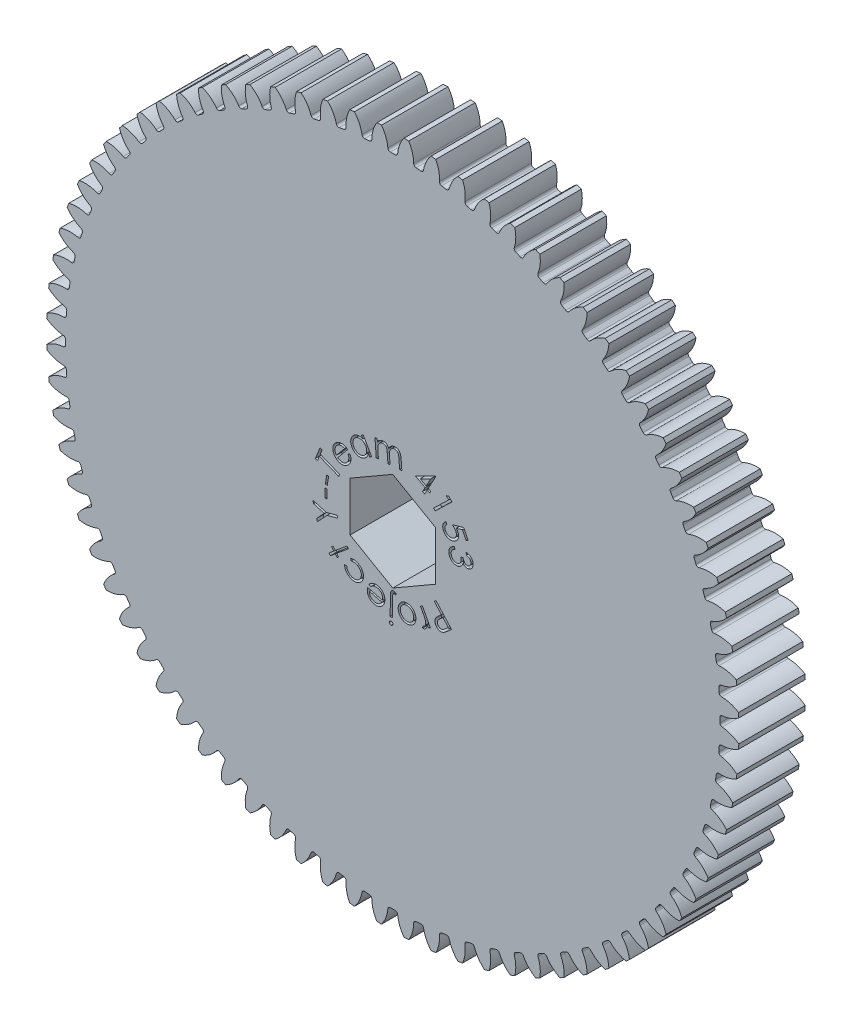
from build123d import *

# Parameters (mm, degrees)
SKETCH1_R                = 52.07
SKETCH1_R_2              = 5
BOSS_EXTRUDE1_DEPTH      = 5
CUT_EXTRUDE1_DEPTH       = 74.807654075
FILLET1_R                = 0.381
CIRPATTERN1_COUNT        = 80
FILLET1_OF_CIRPATTERN1_R = 0.381
CUT_EXTRUDE3_DEPTH       = 75.275471216
CUT_EXTRUDE3_DEPTH_BACK  = 75.275471216
CUT_EXTRUDE4_DEPTH       = 1


with BuildPart() as part:
    # Sketch1 → Boss-Extrude1 (new, symmetric)
    with BuildSketch(Plane.XY):
        Circle(SKETCH1_R)
        Circle(SKETCH1_R_2, mode=Mode.SUBTRACT)
    extrude(amount=BOSS_EXTRUDE1_DEPTH, both=True)

    # Sketch2 → Cut-Extrude1 (cut, symmetric)
    with BuildSketch(Plane.XY):
        with BuildLine():
            ThreePointArc((0.721340206, 49.207213135), (0, 49.2125), (-0.721340206, 49.207213135))
            ThreePointArc((-0.721340206, 49.207213135), (-0.981330856, 50.701949285), (-1.691773999, 52.042509555))
            ThreePointArc((-1.691773999, 52.042509555), (0, 52.07), (1.691773999, 52.042509555))
            ThreePointArc((1.691773999, 52.042509555), (0.981330856, 50.701949285), (0.721340206, 49.207213135))
        make_face()
    cut_extrude1 = extrude(amount=CUT_EXTRUDE1_DEPTH, both=True, mode=Mode.SUBTRACT)

    # Fillet1
    fillet1_edges = [part.edges().sort_by_distance(p)[0] for p in [
        (0.721340206, 49.207213135, 0),
        (-0.721340206, 49.207213135, 0),
    ]]
    fillet(fillet1_edges, radius=FILLET1_R)

    # CirPattern1: Cut-Extrude1 ×80 about axis
    cirpattern1_axis = Axis((0, 0, 5), (0, 0, 1))
    for i in range(1, CIRPATTERN1_COUNT):
        add(cut_extrude1.rotate(cirpattern1_axis, i * 360 / CIRPATTERN1_COUNT), mode=Mode.SUBTRACT)

    # Fillet1 of CirPattern1
    fillet1_of_cirpattern1_edges = [part.edges().sort_by_distance(p)[0] for p in [
        (-3.141636891, 49.11211942, 0),
        (-4.579870001, 48.998928019, 0),
        (-6.985244752, 48.714233156, 0),
        (-8.410163374, 48.488548218, 0),
        (-10.785786256, 48.016007446, 0),
        (-12.188605294, 47.679220393, 0),
        (-14.519829801, 47.021747084, 0),
        (-15.891900408, 46.575934319, 0),
        (-18.164353767, 45.737582014, 0),
        (-19.497216672, 45.185492122, 0),
        (-21.696888452, 44.171429542, 0),
        (-22.982326112, 43.51646634, 0),
        (-25.095654605, 42.332945518, 0),
        (-26.325741869, 41.579147073, 0),
        (-28.339697702, 40.233464807, 0),
        (-29.506850673, 39.385478537, 0),
        (-31.409017139, 37.885931408, 0),
        (-32.506039931, 36.94898543, 0),
        (-34.28468954, 35.304818643, 0),
        (-35.304818643, 34.28468954, 0),
        (-36.94898543, 32.506039931, 0),
        (-37.885931408, 31.409017139, 0),
        (-39.385478537, 29.506850673, 0),
        (-40.233464807, 28.339697702, 0),
        (-41.579147073, 26.325741869, 0),
        (-42.332945518, 25.095654605, 0),
        (-43.51646634, 22.982326112, 0),
        (-44.171429542, 21.696888452, 0),
        (-45.185492122, 19.497216672, 0),
        (-45.737582014, 18.164353767, 0),
        (-46.575934319, 15.891900408, 0),
        (-47.021747084, 14.519829801, 0),
        (-47.679220393, 12.188605294, 0),
        (-48.016007446, 10.785786256, 0),
        (-48.488548218, 8.410163374, 0),
        (-48.714233156, 6.985244752, 0),
        (-48.998928019, 4.579870001, 0),
        (-49.11211942, 3.141636891, 0),
        (-49.207213135, 0.721340206, 0),
        (-49.207213135, -0.721340206, 0),
        (-49.11211942, -3.141636891, 0),
        (-48.998928019, -4.579870001, 0),
        (-48.714233156, -6.985244752, 0),
        (-48.488548218, -8.410163374, 0),
        (-48.016007446, -10.785786256, 0),
        (-47.679220393, -12.188605294, 0),
        (-47.021747084, -14.519829801, 0),
        (-46.575934319, -15.891900408, 0),
        (-45.737582014, -18.164353767, 0),
        (-45.185492122, -19.497216672, 0),
        (-44.171429542, -21.696888452, 0),
        (-43.51646634, -22.982326112, 0),
        (-42.332945518, -25.095654605, 0),
        (-41.579147073, -26.325741869, 0),
        (-40.233464807, -28.339697702, 0),
        (-39.385478537, -29.506850673, 0),
        (-37.885931408, -31.409017139, 0),
        (-36.94898543, -32.506039931, 0),
        (-35.304818643, -34.28468954, 0),
        (-34.28468954, -35.304818643, 0),
        (-32.506039931, -36.94898543, 0),
        (-31.409017139, -37.885931408, 0),
        (-29.506850673, -39.385478537, 0),
        (-28.339697702, -40.233464807, 0),
        (-26.325741869, -41.579147073, 0),
        (-25.095654605, -42.332945518, 0),
        (-22.982326112, -43.51646634, 0),
        (-21.696888452, -44.171429542, 0),
        (-19.497216672, -45.185492122, 0),
        (-18.164353767, -45.737582014, 0),
        (-15.891900408, -46.575934319, 0),
        (-14.519829801, -47.021747084, 0),
        (-12.188605294, -47.679220393, 0),
        (-10.785786256, -48.016007446, 0),
        (-8.410163374, -48.488548218, 0),
        (-6.985244752, -48.714233156, 0),
        (-4.579870001, -48.998928019, 0),
        (-3.141636891, -49.11211942, 0),
        (-0.721340206, -49.207213135, 0),
        (0.721340206, -49.207213135, 0),
        (3.141636891, -49.11211942, 0),
        (4.579870001, -48.998928019, 0),
        (6.985244752, -48.714233156, 0),
        (8.410163374, -48.488548218, 0),
        (10.785786256, -48.016007446, 0),
        (12.188605294, -47.679220393, 0),
        (14.519829801, -47.021747084, 0),
        (15.891900408, -46.575934319, 0),
        (18.164353767, -45.737582014, 0),
        (19.497216672, -45.185492122, 0),
        (21.696888452, -44.171429542, 0),
        (22.982326112, -43.51646634, 0),
        (25.095654605, -42.332945518, 0),
        (26.325741869, -41.579147073, 0),
        (28.339697702, -40.233464807, 0),
        (29.506850673, -39.385478537, 0),
        (31.409017139, -37.885931408, 0),
        (32.506039931, -36.94898543, 0),
        (34.28468954, -35.304818643, 0),
        (35.304818643, -34.28468954, 0),
        (36.94898543, -32.506039931, 0),
        (37.885931408, -31.409017139, 0),
        (39.385478537, -29.506850673, 0),
        (40.233464807, -28.339697702, 0),
        (41.579147073, -26.325741869, 0),
        (42.332945518, -25.095654605, 0),
        (43.51646634, -22.982326112, 0),
        (44.171429542, -21.696888452, 0),
        (45.185492122, -19.497216672, 0),
        (45.737582014, -18.164353767, 0),
        (46.575934319, -15.891900408, 0),
        (47.021747084, -14.519829801, 0),
        (47.679220393, -12.188605294, 0),
        (48.016007446, -10.785786256, 0),
        (48.488548218, -8.410163374, 0),
        (48.714233156, -6.985244752, 0),
        (48.998928019, -4.579870001, 0),
        (49.11211942, -3.141636891, 0),
        (49.207213135, -0.721340206, 0),
        (49.207213135, 0.721340206, 0),
        (49.11211942, 3.141636891, 0),
        (48.998928019, 4.579870001, 0),
        (48.714233156, 6.985244752, 0),
        (48.488548218, 8.410163374, 0),
        (48.016007446, 10.785786256, 0),
        (47.679220393, 12.188605294, 0),
        (47.021747084, 14.519829801, 0),
        (46.575934319, 15.891900408, 0),
        (45.737582014, 18.164353767, 0),
        (45.185492122, 19.497216672, 0),
        (44.171429542, 21.696888452, 0),
        (43.51646634, 22.982326112, 0),
        (42.332945518, 25.095654605, 0),
        (41.579147073, 26.325741869, 0),
        (40.233464807, 28.339697702, 0),
        (39.385478537, 29.506850673, 0),
        (37.885931408, 31.409017139, 0),
        (36.94898543, 32.506039931, 0),
        (35.304818643, 34.28468954, 0),
        (34.28468954, 35.304818643, 0),
        (32.506039931, 36.94898543, 0),
        (31.409017139, 37.885931408, 0),
        (29.506850673, 39.385478537, 0),
        (28.339697702, 40.233464807, 0),
        (26.325741869, 41.579147073, 0),
        (25.095654605, 42.332945518, 0),
        (22.982326112, 43.51646634, 0),
        (21.696888452, 44.171429542, 0),
        (19.497216672, 45.185492122, 0),
        (18.164353767, 45.737582014, 0),
        (15.891900408, 46.575934319, 0),
        (14.519829801, 47.021747084, 0),
        (12.188605294, 47.679220393, 0),
        (10.785786256, 48.016007446, 0),
        (8.410163374, 48.488548218, 0),
        (6.985244752, 48.714233156, 0),
        (4.579870001, 48.998928019, 0),
        (3.141636891, 49.11211942, 0),
    ]]
    fillet(fillet1_of_cirpattern1_edges, radius=FILLET1_OF_CIRPATTERN1_R)

    # Sketch4 → Cut-Extrude3 (cut, two sides: drawn at the far end of the back side and taken through both)
    with BuildSketch(Plane.XY.offset(5).offset(-CUT_EXTRUDE3_DEPTH_BACK)):
        Polygon((6.4135, -3.702835951), (6.4135, 3.702835951), (0, 7.405671903), (-6.4135, 3.702835951), (-6.4135, -3.702835951), (0, -7.405671903), align=None)
    extrude(amount=CUT_EXTRUDE3_DEPTH + CUT_EXTRUDE3_DEPTH_BACK, mode=Mode.SUBTRACT)

    # Sketch5 → Cut-Extrude4 (cut)
    # profile 1 of 19: a face of its own
    with BuildSketch(Plane.XY.offset(5)):
        with BuildLine():
            Line((11.086994033, 2.421998523), (11.033007655, 2.773260543))
            add(Edge.make_bspline(
                [(11.033007655, 2.773260543), (11.069051737, 2.770234986), (11.139562984, 2.76431624), (11.242285705, 2.74751915), (11.339480745, 2.723520747), (11.431617048, 2.693363378), (11.51861601, 2.657245184), (11.599848498, 2.613955679), (11.67613507, 2.564830377), (11.746515926, 2.508847553), (11.811038097, 2.447674595), (11.869880946, 2.382492868), (11.920618982, 2.311928181), (11.966325535, 2.238421527), (12.003026715, 2.15962258), (12.035130397, 2.077455062), (12.0596839, 1.990542833), (12.070243914, 1.930619673), (12.075575764, 1.900363908)],
                knots=[0, 0, 0, 0, 1.172447719, 2.293601181, 3.370557348, 4.415309804, 5.434186328, 6.42059287, 7.395818156, 8.372132045, 9.331598375, 10.276137389, 11.21430245, 12.146080765, 13.078136337, 14.028009717, 15.004323606, 16, 16, 16, 16], degree=3))
            add(Edge.make_bspline(
                [(12.075575764, 1.900363908), (12.080940789, 1.856025554), (12.09159257, 1.767995681), (12.087052041, 1.635597236), (12.068564196, 1.50502285), (12.032476351, 1.378593452), (11.983567917, 1.25842715), (11.920513738, 1.14862502), (11.845189409, 1.049874318), (11.756591557, 0.965087276), (11.660343649, 0.89283282), (11.558140269, 0.835506587), (11.450705304, 0.793526765), (11.376147053, 0.778436482), (11.338696757, 0.770856697)],
                knots=[0, 0, 0, 0, 1.073801399, 2.131937515, 3.178280427, 4.241728444, 5.288676267, 6.29430666, 7.281253805, 8.268040562, 9.236908235, 10.171397922, 11.081500861, 12, 12, 12, 12], degree=3))
            add(Edge.make_bspline(
                [(11.338696757, 0.770856697), (11.302293122, 0.766538455), (11.230523816, 0.758025097), (11.123257559, 0.763487527), (11.019772731, 0.782970421), (10.920285801, 0.81818088), (10.824382625, 0.867508532), (10.732721136, 0.932464967), (10.644326873, 1.011396754), (10.591322372, 1.072858936), (10.563957174, 1.104590671)],
                knots=[0, 0, 0, 0, 0.991004746, 1.953753338, 2.894354245, 3.832846011, 4.800633632, 5.804661443, 6.866589197, 8, 8, 8, 8], degree=3))
            add(Edge.make_bspline(
                [(10.563957174, 1.104590671), (10.552440835, 1.06167913), (10.529812612, 0.977363103), (10.477287039, 0.858777728), (10.413268025, 0.748296138), (10.359043605, 0.683444932), (10.33188586, 0.65096487)],
                knots=[0, 0, 0, 0, 1.034396071, 2.032464112, 3.014579789, 4, 4, 4, 4], degree=3))
            add(Edge.make_bspline(
                [(10.33188586, 0.65096487), (10.311903857, 0.629576692), (10.272354791, 0.587244478), (10.207393962, 0.530469411), (10.139527603, 0.479862312), (10.068454569, 0.436150559), (9.99421259, 0.39951687), (9.916913473, 0.369156867), (9.836085965, 0.345952065), (9.780669317, 0.33571035), (9.752759257, 0.330552209)],
                knots=[0, 0, 0, 0, 1.039473192, 2.057360955, 3.060508799, 4.044641187, 5.017639541, 5.998402805, 6.991914902, 8, 8, 8, 8], degree=3))
            add(Edge.make_bspline(
                [(9.752759257, 0.330552209), (9.70398357, 0.324970448), (9.606788746, 0.313847729), (9.45914741, 0.321766521), (9.312527827, 0.349639055), (9.192343374, 0.388136942), (9.098441109, 0.427513546), (9.031239966, 0.463151715), (8.96643803, 0.501350911), (8.90523274, 0.544509972), (8.847188337, 0.591387971), (8.791884799, 0.64220203), (8.740398164, 0.697524206), (8.675463656, 0.776231791), (8.605035807, 0.883647155), (8.536385479, 1.0231809), (8.484186048, 1.173396202), (8.464827586, 1.278834483), (8.454982815, 1.332455254)],
                knots=[0, 0, 0, 0, 1.288308155, 2.567198802, 3.866874602, 5.201203046, 5.875361937, 6.540112058, 7.198390841, 7.850943727, 8.50603484, 9.157951624, 9.822730113, 10.490339387, 11.837677745, 13.186247264, 14.569062503, 16, 16, 16, 16], degree=3))
            add(Edge.make_bspline(
                [(8.454982815, 1.332455254), (8.449918343, 1.369084603), (8.44001441, 1.440715871), (8.435963868, 1.547495088), (8.440846195, 1.650683619), (8.454123792, 1.750633029), (8.475817872, 1.847429257), (8.506714884, 1.940604881), (8.546354737, 2.030542118), (8.594613985, 2.116533923), (8.651613247, 2.198523029), (8.718032393, 2.274688532), (8.791764857, 2.346974146), (8.874918698, 2.41251299), (8.966093119, 2.473288031), (9.065787802, 2.528490336), (9.17414349, 2.578446946), (9.250317562, 2.606668185), (9.289317751, 2.621117113)],
                knots=[0, 0, 0, 0, 1.050901157, 2.055111177, 3.033055656, 3.98507683, 4.918478486, 5.849393119, 6.771729907, 7.708908621, 8.649074573, 9.605538197, 10.578298808, 11.58081444, 12.611070449, 13.690882352, 14.817760126, 16, 16, 16, 16], degree=3))
            Line((9.289317751, 2.621117113), (9.341901886, 2.28387753))
            add(Edge.make_bspline(
                [(9.341901886, 2.28387753), (9.316039577, 2.272278053), (9.265747962, 2.249721815), (9.19486046, 2.211485131), (9.129878959, 2.172335145), (9.070069858, 2.132667503), (9.017881996, 2.089726286), (8.97120874, 2.046014468), (8.929745511, 2.001394888), (8.907090748, 1.968881662), (8.895988424, 1.952948043)],
                knots=[0, 0, 0, 0, 1.208766921, 2.35055732, 3.432823086, 4.444852479, 5.408641591, 6.311409378, 7.172479543, 8, 8, 8, 8], degree=3))
            add(Edge.make_bspline(
                [(8.895988424, 1.952948043), (8.883613773, 1.932626979), (8.858823868, 1.891918172), (8.82990084, 1.82650525), (8.806462243, 1.758774572), (8.78944712, 1.688377598), (8.779873542, 1.615050019), (8.7765282, 1.539081506), (8.778964233, 1.46021418), (8.786349466, 1.40719405), (8.790119033, 1.380131536)],
                knots=[0, 0, 0, 0, 0.957190044, 1.917520847, 2.872858562, 3.840676453, 4.828242219, 5.845712199, 6.900409282, 8, 8, 8, 8], degree=3))
            add(Edge.make_bspline(
                [(8.790119033, 1.380131536), (8.79533379, 1.349606918), (8.805510342, 1.290038398), (8.831043817, 1.20477483), (8.860490975, 1.124628109), (8.897371429, 1.050504972), (8.940138987, 0.981796989), (8.990320533, 0.919503395), (9.045946398, 0.862161543), (9.107375466, 0.811249751), (9.173106551, 0.767601724), (9.240268299, 0.730237441), (9.308934681, 0.700171264), (9.37915571, 0.678799073), (9.450660919, 0.663530184), (9.523560511, 0.65674123), (9.597817683, 0.65730057), (9.647161374, 0.66333567), (9.672130251, 0.666389549)],
                knots=[0, 0, 0, 0, 1.172367416, 2.287864531, 3.366872934, 4.404530791, 5.419299552, 6.427555365, 7.429569015, 8.442132722, 9.444263769, 10.415393542, 11.351487895, 12.278658844, 13.19223836, 14.117504117, 15.047420117, 16, 16, 16, 16], degree=3))
            add(Edge.make_bspline(
                [(9.672130251, 0.666389549), (9.705135965, 0.672825982), (9.770748089, 0.685620979), (9.864099836, 0.723359684), (9.951941555, 0.773767415), (10.03358679, 0.836482027), (10.106201468, 0.910612858), (10.167962551, 0.993609824), (10.215669027, 1.08546438), (10.246172372, 1.167972876), (10.263392577, 1.239991342), (10.274077062, 1.300826516), (10.280778499, 1.367840466), (10.284033646, 1.441091184), (10.284612467, 1.520365888), (10.282630739, 1.605732809), (10.276713326, 1.697362281), (10.271032105, 1.760385643), (10.268083777, 1.793092273)],
                knots=[0, 0, 0, 0, 1.126395439, 2.23916374, 3.359892192, 4.517664301, 5.682402785, 6.83228393, 7.976049784, 9.144716571, 9.774390764, 10.459106666, 11.21614727, 12.032803173, 12.919142219, 13.876326435, 14.897897457, 16, 16, 16, 16], degree=3))
            Line((10.268083777, 1.793092273), (10.584990828, 1.842170799))
            add(Edge.make_bspline(
                [(10.584990828, 1.842170799), (10.591968516, 1.803676293), (10.60565011, 1.728197682), (10.63840414, 1.619448695), (10.680146352, 1.517461119), (10.731790851, 1.424037849), (10.789999812, 1.341586819), (10.851697392, 1.2707362), (10.91807854, 1.214580246), (10.988220125, 1.172376839), (11.061134672, 1.144551814), (11.13493824, 1.127375321), (11.210269794, 1.120995239), (11.260203546, 1.126866885), (11.285411501, 1.129831056)],
                knots=[0, 0, 0, 0, 1.265675655, 2.481690249, 3.668955865, 4.827104902, 5.92915607, 6.931314669, 7.86031793, 8.732267783, 9.568255349, 10.375787383, 11.180052055, 12, 12, 12, 12], degree=3))
            add(Edge.make_bspline(
                [(11.285411501, 1.129831056), (11.303732776, 1.133172296), (11.340173373, 1.139817946), (11.392699552, 1.156713803), (11.442151902, 1.179432965), (11.488711461, 1.207179486), (11.533233131, 1.239121486), (11.57403121, 1.277839121), (11.61258916, 1.321003044), (11.647472334, 1.369611212), (11.678556537, 1.421355765), (11.705246386, 1.475740637), (11.724371097, 1.532976414), (11.739453561, 1.591969883), (11.748400096, 1.653283992), (11.75209909, 1.71664864), (11.748958368, 1.782093166), (11.74331428, 1.826077905), (11.740439546, 1.848480895)],
                knots=[0, 0, 0, 0, 0.943453473, 1.876507356, 2.788483302, 3.696834314, 4.621119835, 5.560098406, 6.542123571, 7.551781074, 8.588131372, 9.600358071, 10.61583897, 11.641773422, 12.684067383, 13.752107446, 14.85506841, 16, 16, 16, 16], degree=3))
            add(Edge.make_bspline(
                [(11.740439546, 1.848480895), (11.73339487, 1.884306294), (11.719682628, 1.954039319), (11.680348281, 2.052031004), (11.625461559, 2.139133786), (11.568461771, 2.203586625), (11.515076845, 2.249416467), (11.469436004, 2.281811504), (11.418031714, 2.310637258), (11.362259962, 2.338761051), (11.300661739, 2.362474199), (11.234320233, 2.385189589), (11.162785934, 2.405690823), (11.112773155, 2.416451781), (11.086994033, 2.421998523)],
                knots=[0, 0, 0, 0, 1.402466647, 2.729857699, 4.034642752, 5.34659565, 6.02245237, 6.738446215, 7.49570687, 8.287874755, 9.1394096, 10.032239796, 10.985716623, 12, 12, 12, 12], degree=3))
        make_face()
    # profile 2 of 19: a face of its own
    with BuildSketch(Plane.XY.offset(5)):
        with BuildLine():
            Line((11.33494142, 4.460609964), (11.037665779, 4.313374387))
            Line((11.037665779, 4.313374387), (10.485181805, 5.426755797))
            Line((10.485181805, 5.426755797), (9.555494305, 5.158226149))
            add(Edge.make_bspline(
                [(9.555494305, 5.158226149), (9.580870451, 5.129788662), (9.630219566, 5.074486138), (9.695721433, 4.989191169), (9.752364347, 4.905545826), (9.782671116, 4.848145999), (9.797381324, 4.820285444)],
                knots=[0, 0, 0, 0, 1.096731546, 2.132819274, 3.093713444, 4, 4, 4, 4], degree=3))
            add(Edge.make_bspline(
                [(9.797381324, 4.820285444), (9.814046514, 4.785077379), (9.846757445, 4.715969939), (9.881895544, 4.608446532), (9.908022674, 4.501893352), (9.920908215, 4.395085781), (9.924345558, 4.288896096), (9.914763484, 4.182892513), (9.894332005, 4.077178842), (9.862715281, 3.972808622), (9.821871957, 3.871280685), (9.770335091, 3.775534528), (9.709484001, 3.686013018), (9.640169192, 3.601981965), (9.5599767, 3.525469366), (9.471180953, 3.454620974), (9.373727017, 3.388526381), (9.302802887, 3.351890259), (9.266632126, 3.333206117)],
                knots=[0, 0, 0, 0, 1.055115737, 2.07101263, 3.060785946, 4.025123005, 4.982251176, 5.936270143, 6.904326313, 7.89663167, 8.888552574, 9.866594073, 10.838458406, 11.819307872, 12.814138826, 13.837360289, 14.897070359, 16, 16, 16, 16], degree=3))
            add(Edge.make_bspline(
                [(9.266632126, 3.333206117), (9.21525448, 3.309949999), (9.11396544, 3.264101461), (8.954575533, 3.21824709), (8.792848433, 3.194633539), (8.657162718, 3.191253348), (8.549825455, 3.199890627), (8.470998718, 3.210718879), (8.394632276, 3.228112665), (8.319823112, 3.248585668), (8.247811811, 3.275855803), (8.177251741, 3.306117363), (8.109774183, 3.343364429), (8.043889947, 3.384323982), (7.980962796, 3.430640721), (7.921207125, 3.481215778), (7.864738834, 3.536271778), (7.811624006, 3.596002326), (7.760847868, 3.660000433), (7.713372501, 3.728644364), (7.668923772, 3.801603146), (7.642747689, 3.852795421), (7.629512735, 3.878678874)],
                knots=[0, 0, 0, 0, 1.748019681, 3.446153187, 5.124778455, 6.807345338, 7.643732339, 8.464062161, 9.27332621, 10.07209539, 10.868128429, 11.66028845, 12.451917354, 13.256621032, 14.065852597, 14.873555991, 15.683696587, 16.510442191, 17.351811555, 18.216690737, 19.098336611, 20, 20, 20, 20], degree=3))
            add(Edge.make_bspline(
                [(7.629512735, 3.878678874), (7.614723022, 3.910236172), (7.58571654, 3.97212826), (7.551890874, 4.06762815), (7.527289091, 4.162896811), (7.511711078, 4.258163951), (7.505047303, 4.353269085), (7.509027035, 4.448100541), (7.520865489, 4.54293616), (7.541819925, 4.636815542), (7.57122841, 4.728540894), (7.608463642, 4.816593266), (7.653480809, 4.900025951), (7.705431094, 4.979171926), (7.765847736, 5.053107515), (7.833027634, 5.123346085), (7.908178192, 5.188795726), (7.962901088, 5.227622543), (7.990590459, 5.247268617)],
                knots=[0, 0, 0, 0, 1.075864627, 2.110051018, 3.123680859, 4.110960562, 5.087549161, 6.062642873, 7.037603, 8.035798582, 9.028761123, 10.008758047, 10.984038745, 11.952968548, 12.928062259, 13.928629814, 14.951902407, 16, 16, 16, 16], degree=3))
            Line((7.990590459, 5.247268617), (8.149745106, 4.926855957))
            add(Edge.make_bspline(
                [(8.149745106, 4.926855957), (8.124021725, 4.906127581), (8.074468299, 4.866196515), (8.010382449, 4.799564168), (7.956872291, 4.731639596), (7.915872997, 4.660280352), (7.884060999, 4.586308885), (7.863576093, 4.507771445), (7.850712985, 4.425090753), (7.84734562, 4.339001298), (7.853628578, 4.252004598), (7.869323443, 4.166524126), (7.89327199, 4.083095366), (7.917453184, 4.030556), (7.929592863, 4.004179675)],
                knots=[0, 0, 0, 0, 1.148081973, 2.211660849, 3.208426699, 4.148202182, 5.066207146, 6.000941125, 6.963265394, 7.972124082, 8.990923467, 9.990701451, 10.991272334, 12, 12, 12, 12], degree=3))
            add(Edge.make_bspline(
                [(7.929592863, 4.004179675), (7.942883215, 3.979342269), (7.969091773, 3.930362936), (8.016791698, 3.86258623), (8.069843821, 3.800780113), (8.12936278, 3.745521022), (8.194896795, 3.697148912), (8.266222375, 3.654693896), (8.343651259, 3.61915284), (8.425923042, 3.589722221), (8.511416347, 3.568334581), (8.597991185, 3.55458289), (8.684942149, 3.550605536), (8.771812923, 3.554748998), (8.859186097, 3.567564833), (8.946571725, 3.589266356), (9.034214251, 3.620468924), (9.091088948, 3.647064847), (9.12009767, 3.660629996)],
                knots=[0, 0, 0, 0, 0.978978879, 1.930545076, 2.875666987, 3.807412197, 4.748681455, 5.703574573, 6.689111553, 7.707194765, 8.738239498, 9.749877639, 10.75084679, 11.759934661, 12.770363861, 13.817179775, 14.886660859, 16, 16, 16, 16], degree=3))
            add(Edge.make_bspline(
                [(9.12009767, 3.660629996), (9.145607596, 3.673952453), (9.195781332, 3.700155486), (9.264803939, 3.746538062), (9.327418028, 3.796745277), (9.383245861, 3.85143288), (9.431279585, 3.911504681), (9.474366577, 3.974631391), (9.508259021, 4.043416739), (9.536589808, 4.115268923), (9.556672902, 4.19033385), (9.56956082, 4.266860351), (9.573724629, 4.344696595), (9.569434354, 4.423420733), (9.55664208, 4.503291361), (9.53506391, 4.584033378), (9.506742671, 4.666426191), (9.481463321, 4.720008586), (9.468555203, 4.747368778)],
                knots=[0, 0, 0, 0, 1.07408952, 2.112553545, 3.099415045, 4.068360443, 5.023887472, 5.967945677, 6.91643138, 7.880806255, 8.84837489, 9.812591774, 10.774079234, 11.752996888, 12.751674753, 13.78896446, 14.87100311, 16, 16, 16, 16], degree=3))
            add(Edge.make_bspline(
                [(9.468555203, 4.747368778), (9.456243298, 4.77068114), (9.43087704, 4.818711678), (9.385697462, 4.889348901), (9.33340323, 4.960948043), (9.274652509, 5.034129863), (9.207502002, 5.107208318), (9.134800299, 5.182771868), (9.053859366, 5.258039007), (8.99705727, 5.307939608), (8.967954241, 5.333506598)],
                knots=[0, 0, 0, 0, 0.81541681, 1.680005965, 2.591203579, 3.557863924, 4.581733205, 5.660676635, 6.801428136, 8, 8, 8, 8], degree=3))
            Line((8.967954241, 5.333506598), (10.663266741, 5.813775028))
            Line((10.663266741, 5.813775028), (11.33494142, 4.460609964))
        make_face()
    # profile 3 of 19: a face of its own
    with BuildSketch(Plane.XY.offset(5)):
        Polygon((8.425130471, 8.763383937), (8.903295535, 8.269794194), (6.389072779, 5.833395956), (6.147886881, 6.082995315), (8.416015887, 8.281012142), (8.033203387, 8.675743713), align=None)
    # profile 4 of 19: a face of its own
    with BuildSketch(Plane.XY.offset(5)):
        Polygon((6.424102862, 10.410243267), (6.486502701, 10.376589421), (5.338065201, 8.243075799), (5.708257509, 8.04395721), (5.549803984, 7.750187178), (5.179611676, 7.949305767), (4.796799176, 7.237667146), (4.490408951, 7.403131889), (4.873221451, 8.114770511), (3.409980266, 8.902130287), align=None)
        Polygon((5.031674977, 8.408540543), (5.718774336, 9.68458221), (4.130733471, 8.893015703), align=None, mode=Mode.SUBTRACT)
    # profile 5 of 19: a face of its own
    with BuildSketch(Plane.XY.offset(5)):
        with BuildLine():
            Line((-2.673284491, 10.873778749), (-2.34445837, 10.898318012))
            Line((-2.34445837, 10.898318012), (-2.311505645, 10.453806794))
            add(Edge.make_bspline(
                [(-2.311505645, 10.453806794), (-2.286092234, 10.494767544), (-2.237393681, 10.573258749), (-2.155248663, 10.677804864), (-2.072733836, 10.767910809), (-2.011824627, 10.816279382), (-1.982679524, 10.839423781)],
                knots=[0, 0, 0, 0, 1.133522597, 2.172117325, 3.125356738, 4, 4, 4, 4], degree=3))
            add(Edge.make_bspline(
                [(-1.982679524, 10.839423781), (-1.942693677, 10.865870576), (-1.8639901, 10.917925427), (-1.735576805, 10.974324083), (-1.603106996, 11.01380762), (-1.512244433, 11.024208911), (-1.466653882, 11.029427788)],
                knots=[0, 0, 0, 0, 1.03203699, 2.031343806, 3.012221133, 4, 4, 4, 4], degree=3))
            add(Edge.make_bspline(
                [(-1.466653882, 11.029427788), (-1.435803816, 11.030759671), (-1.374489219, 11.033406792), (-1.282988081, 11.026201297), (-1.193291411, 11.009136635), (-1.10630134, 10.983165694), (-1.0233263, 10.950227884), (-0.947188775, 10.909084652), (-0.877752832, 10.862285069), (-0.815313352, 10.806690258), (-0.757586156, 10.741598119), (-0.703424918, 10.664183753), (-0.652357989, 10.573391425), (-0.622650789, 10.50689352), (-0.607078562, 10.472035961)],
                knots=[0, 0, 0, 0, 1.006213268, 1.999851825, 2.984831376, 3.978294569, 4.956172944, 5.890404576, 6.795106889, 7.680505195, 8.608937382, 9.625972465, 10.755557689, 12, 12, 12, 12], degree=3))
            add(Edge.make_bspline(
                [(-0.607078562, 10.472035961), (-0.594965697, 10.497647587), (-0.571087987, 10.548134983), (-0.530978364, 10.620573211), (-0.487737793, 10.688553416), (-0.440867505, 10.751660143), (-0.392960115, 10.811732025), (-0.340924718, 10.866652315), (-0.285061584, 10.916096565), (-0.20933941, 10.977699877), (-0.108395054, 11.043186133), (0.020827612, 11.102353697), (0.156382051, 11.143044692), (0.249669097, 11.153744646), (0.296667432, 11.15913532)],
                knots=[0, 0, 0, 0, 0.85418593, 1.683829963, 2.49516198, 3.281720094, 4.053295991, 4.811036373, 5.559610071, 6.301452034, 7.75389131, 9.172982056, 10.575738616, 12, 12, 12, 12], degree=3))
            add(Edge.make_bspline(
                [(0.296667432, 11.15913532), (0.340182979, 11.160983587), (0.425253196, 11.164596837), (0.550193969, 11.146539533), (0.668727942, 11.113090669), (0.779796394, 11.061536037), (0.881591268, 10.994350523), (0.971760566, 10.912031072), (1.048977935, 10.815103776), (1.102595965, 10.723165547), (1.139717265, 10.640898449), (1.164545443, 10.570368828), (1.187762715, 10.492520355), (1.208026565, 10.40659473), (1.22503053, 10.312897042), (1.240767679, 10.21149102), (1.253012872, 10.10244988), (1.25948224, 10.027072909), (1.262813265, 9.988261922)],
                knots=[0, 0, 0, 0, 1.207682956, 2.36094589, 3.489098938, 4.619118678, 5.748168123, 6.864904529, 7.99648991, 9.177936661, 9.811450593, 10.5014953, 11.253341963, 12.067502813, 12.952515363, 13.898289813, 14.917846609, 16, 16, 16, 16], degree=3))
            Line((1.262813265, 9.988261922), (1.365878169, 8.582512724))
            Line((1.365878169, 8.582512724), (1.027937464, 8.557272339))
            Line((1.027937464, 8.557272339), (0.92487256, 9.963021538))
            add(Edge.make_bspline(
                [(0.92487256, 9.963021538), (0.922249181, 9.99622501), (0.91721881, 10.059893202), (0.907131358, 10.151006465), (0.896986236, 10.233841404), (0.885062711, 10.308444661), (0.871960916, 10.374920077), (0.857511037, 10.433294323), (0.841279383, 10.483312143), (0.819464132, 10.539114536), (0.785198365, 10.599635015), (0.734977668, 10.66391197), (0.673718387, 10.718887941), (0.603640687, 10.765153374), (0.525442999, 10.801100511), (0.440353034, 10.825013047), (0.348832433, 10.836542748), (0.286169018, 10.833816506), (0.253899002, 10.832412563)],
                knots=[0, 0, 0, 0, 1.264195942, 2.424116029, 3.479337667, 4.431697963, 5.291148901, 6.050657687, 6.712734551, 7.286006986, 8.322567974, 9.339507253, 10.369480065, 11.432392627, 12.516055844, 13.62250072, 14.775650225, 16, 16, 16, 16], degree=3))
            add(Edge.make_bspline(
                [(0.253899002, 10.832412563), (0.214615072, 10.827858758), (0.136555429, 10.81881006), (0.02430764, 10.78243819), (-0.082019354, 10.730170347), (-0.179035785, 10.659715431), (-0.266972101, 10.57696892), (-0.340710461, 10.480915418), (-0.399673374, 10.373955948), (-0.437961259, 10.276131807), (-0.459885969, 10.189105128), (-0.473069384, 10.113412332), (-0.48246695, 10.028176689), (-0.488934068, 9.933207017), (-0.490286101, 9.828644295), (-0.490028804, 9.714544734), (-0.4847001, 9.590641796), (-0.478958573, 9.504943114), (-0.475968786, 9.460317211)],
                knots=[0, 0, 0, 0, 1.07598025, 2.138040525, 3.198110989, 4.294389958, 5.394107923, 6.479985864, 7.581013732, 8.714655414, 9.332837174, 10.025305919, 10.807790698, 11.669919107, 12.61953835, 13.658192605, 14.780549871, 16, 16, 16, 16], degree=3))
            Line((-0.475968786, 9.460317211), (-0.401649876, 8.45210407))
            Line((-0.401649876, 8.45210407), (-0.730475998, 8.428265929))
            Line((-0.730475998, 8.428265929), (-0.827230806, 9.746374903))
            add(Edge.make_bspline(
                [(-0.827230806, 9.746374903), (-0.830083502, 9.78355128), (-0.835560688, 9.85493002), (-0.846381962, 9.957257036), (-0.857104845, 10.050388175), (-0.869885655, 10.13380177), (-0.882935146, 10.207787719), (-0.897320165, 10.272238561), (-0.913474829, 10.327205842), (-0.935345137, 10.387565477), (-0.969157495, 10.452927207), (-1.020628252, 10.521329913), (-1.081977865, 10.580762861), (-1.153298714, 10.629684671), (-1.231965122, 10.668616708), (-1.317587686, 10.694833512), (-1.409545034, 10.70678309), (-1.472243107, 10.704553663), (-1.504514459, 10.703406153)],
                knots=[0, 0, 0, 0, 1.329816653, 2.553251381, 3.669907899, 4.673153175, 5.562627596, 6.349247327, 7.027118453, 7.604700554, 8.637433226, 9.63773058, 10.645812466, 11.670168023, 12.710275535, 13.765010977, 14.849627842, 16, 16, 16, 16], degree=3))
            add(Edge.make_bspline(
                [(-1.504514459, 10.703406153), (-1.54216288, 10.699076721), (-1.617195589, 10.690448233), (-1.725631066, 10.654486161), (-1.829039717, 10.602766846), (-1.925869847, 10.534954801), (-2.013382217, 10.453187249), (-2.088341924, 10.359204491), (-2.149333101, 10.253910282), (-2.188106756, 10.157379649), (-2.211027455, 10.072438135), (-2.225960765, 10.00088299), (-2.235967098, 9.921395016), (-2.242887694, 9.834598226), (-2.246252645, 9.740328239), (-2.246089133, 9.63860922), (-2.242605805, 9.529178898), (-2.23764818, 9.453761319), (-2.23508337, 9.414744294)],
                knots=[0, 0, 0, 0, 1.08550916, 2.163402662, 3.258593278, 4.395826831, 5.544560615, 6.685647031, 7.834106471, 9.026431856, 9.659606037, 10.358315507, 11.123125023, 11.95778812, 12.857469582, 13.830328477, 14.877527932, 16, 16, 16, 16], degree=3))
            Line((-2.23508337, 9.414744294), (-2.155155485, 8.323798781))
            Line((-2.155155485, 8.323798781), (-2.483981607, 8.299259518))
            Line((-2.483981607, 8.299259518), (-2.673284491, 10.873778749))
        make_face()
    # profile 6 of 19: a face of its own
    with BuildSketch(Plane.XY.offset(5)):
        with BuildLine():
            Line((-4.449448483, 10.335462151), (-3.160786624, 8.094676895))
            Line((-3.160786624, 8.094676895), (-3.445442073, 7.930614395))
            Line((-3.445442073, 7.930614395), (-3.66699656, 8.31553026))
            add(Edge.make_bspline(
                [(-3.66699656, 8.31553026), (-3.677103403, 8.262909521), (-3.696851176, 8.160093792), (-3.744815788, 8.012803722), (-3.805425579, 7.875735823), (-3.880407774, 7.749246302), (-3.968312297, 7.633368473), (-4.070396589, 7.529397022), (-4.184471432, 7.434508953), (-4.269491671, 7.382264212), (-4.312729733, 7.355694523)],
                knots=[0, 0, 0, 0, 1.072761657, 2.096070341, 3.095978649, 4.070148989, 5.035773018, 6.002747308, 6.984273198, 8, 8, 8, 8], degree=3))
            add(Edge.make_bspline(
                [(-4.312729733, 7.355694523), (-4.352301331, 7.334317068), (-4.430197112, 7.292236038), (-4.552715292, 7.243721748), (-4.676777004, 7.208539208), (-4.802967943, 7.186750314), (-4.930774342, 7.177166442), (-5.060650511, 7.182833624), (-5.192479873, 7.200082803), (-5.324260991, 7.231819127), (-5.453161265, 7.274775519), (-5.575745064, 7.328932329), (-5.690549773, 7.393452721), (-5.797302062, 7.469285338), (-5.896398131, 7.555534997), (-5.987025947, 7.65317044), (-6.070770237, 7.760754593), (-6.118420198, 7.839419273), (-6.142657618, 7.879432504)],
                knots=[0, 0, 0, 0, 1.018692867, 2.00527354, 2.979533902, 3.936593075, 4.903104337, 5.878458469, 6.87781131, 7.912084768, 8.94559835, 9.953492047, 10.944938169, 11.925242094, 12.916362708, 13.916992212, 14.940466411, 16, 16, 16, 16], degree=3))
            add(Edge.make_bspline(
                [(-6.142657618, 7.879432504), (-6.164499369, 7.919703242), (-6.20750091, 7.998987352), (-6.257347002, 8.123391162), (-6.293860554, 8.249332688), (-6.318094516, 8.376790297), (-6.328596865, 8.506037856), (-6.325712337, 8.637127972), (-6.309162608, 8.769929701), (-6.280713807, 8.90277412), (-6.240368735, 9.032337681), (-6.189214261, 9.155453576), (-6.127492888, 9.270701586), (-6.053912859, 9.376424811), (-5.971704617, 9.475227086), (-5.877426253, 9.564162985), (-5.77370192, 9.646441735), (-5.69750992, 9.692846314), (-5.658883579, 9.716371606)],
                knots=[0, 0, 0, 0, 1.040743687, 2.048992457, 3.039277206, 4.017691183, 4.993172765, 5.981560347, 6.993065124, 8.030902952, 9.065990382, 10.073356964, 11.057466132, 12.031543403, 12.996786479, 13.973771472, 14.97278199, 16, 16, 16, 16], degree=3))
            add(Edge.make_bspline(
                [(-5.658883579, 9.716371606), (-5.613137834, 9.740867242), (-5.523219993, 9.789015865), (-5.381065881, 9.840983616), (-5.237139017, 9.874257906), (-5.091338393, 9.889084692), (-4.943815068, 9.885712888), (-4.794989737, 9.862379363), (-4.644317849, 9.822106146), (-4.546938733, 9.780913249), (-4.497124765, 9.759841158)],
                knots=[0, 0, 0, 0, 1.027632298, 2.019914143, 2.989750594, 3.949040193, 4.917559029, 5.906243911, 6.928945932, 8, 8, 8, 8], degree=3))
            Line((-4.497124765, 9.759841158), (-4.734103932, 10.171399651))
            Line((-4.734103932, 10.171399651), (-4.449448483, 10.335462151))
        make_face()
        with BuildLine():
            add(Edge.make_bspline(
                [(-5.475890791, 9.45204869), (-5.514769915, 9.427886395), (-5.591414469, 9.380253936), (-5.692149913, 9.290402885), (-5.781832562, 9.190873662), (-5.855228232, 9.078196424), (-5.915872995, 8.958032614), (-5.956637598, 8.829615846), (-5.982894447, 8.695991006), (-5.988791668, 8.558030915), (-5.979906156, 8.419888545), (-5.951575298, 8.285652798), (-5.909152061, 8.156020197), (-5.866670672, 8.075922178), (-5.845381977, 8.035782664)],
                knots=[0, 0, 0, 0, 1.011428025, 1.993883653, 2.975876186, 3.968653917, 4.961067738, 5.945808403, 6.941022236, 7.966518707, 8.993266801, 9.996567148, 10.996019834, 12, 12, 12, 12], degree=3))
            add(Edge.make_bspline(
                [(-5.845381977, 8.035782664), (-5.821358512, 7.997456076), (-5.773462808, 7.921044161), (-5.683806788, 7.818684196), (-5.580194056, 7.728584107), (-5.465386128, 7.649750719), (-5.341640881, 7.585560971), (-5.212261219, 7.538577513), (-5.079152047, 7.510526025), (-4.944069802, 7.499814305), (-4.809701883, 7.507737028), (-4.678818004, 7.532250308), (-4.552556619, 7.574195236), (-4.474187011, 7.615396722), (-4.434724926, 7.636143241)],
                knots=[0, 0, 0, 0, 1.000235745, 1.994175106, 2.998817492, 4.033574182, 5.070321163, 6.076893699, 7.071412001, 8.073038597, 9.068108598, 10.042310429, 11.01422866, 12, 12, 12, 12], degree=3))
            add(Edge.make_bspline(
                [(-4.434724926, 7.636143241), (-4.396574732, 7.659870449), (-4.320390518, 7.707252611), (-4.219766037, 7.79703275), (-4.12932571, 7.898282458), (-4.052312745, 8.011711358), (-3.99023075, 8.133769886), (-3.944464902, 8.260591353), (-3.918353868, 8.391481002), (-3.910731781, 8.524798105), (-3.921485661, 8.659183112), (-3.949778033, 8.792585349), (-3.996021975, 8.924425901), (-4.04048593, 9.007365565), (-4.063130374, 9.049604779)],
                knots=[0, 0, 0, 0, 0.990990959, 1.978964212, 2.966478614, 3.984723956, 4.998455869, 5.984862753, 6.953941259, 7.936624792, 8.925865525, 9.923359075, 10.942415758, 12, 12, 12, 12], degree=3))
            add(Edge.make_bspline(
                [(-4.063130374, 9.049604779), (-4.08216922, 9.081082995), (-4.119508988, 9.142819368), (-4.184965378, 9.227535878), (-4.255514777, 9.303874173), (-4.331641658, 9.372112136), (-4.414292701, 9.430320324), (-4.502325807, 9.480405593), (-4.596084917, 9.521819498), (-4.694180904, 9.554608696), (-4.794730277, 9.577464392), (-4.895400983, 9.591283562), (-4.995018198, 9.59379614), (-5.093810095, 9.587217253), (-5.191211286, 9.568460721), (-5.287999573, 9.540282171), (-5.383643452, 9.501771581), (-5.444865764, 9.468771709), (-5.475890791, 9.45204869)],
                knots=[0, 0, 0, 0, 1.076556872, 2.11138769, 3.128367781, 4.117281713, 5.099017969, 6.082851139, 7.078608848, 8.095773141, 9.106817882, 10.09407276, 11.066268759, 12.020006662, 12.987784498, 13.964522538, 14.968501176, 16, 16, 16, 16], degree=3))
        make_face(mode=Mode.SUBTRACT)
    # profile 7 of 19: a face of its own
    with BuildSketch(Plane.XY.offset(5)):
        with BuildLine():
            Line((-6.710296655, 6.692220135), (-6.41933111, 6.813514205))
            add(Edge.make_bspline(
                [(-6.41933111, 6.813514205), (-6.401110518, 6.767960365), (-6.365667244, 6.679347591), (-6.325471082, 6.546025588), (-6.298955915, 6.41671038), (-6.286355937, 6.291249779), (-6.28564368, 6.169195413), (-6.296005245, 6.049386636), (-6.318778535, 5.931890559), (-6.351849087, 5.815824488), (-6.396669496, 5.701543071), (-6.456143161, 5.589381879), (-6.527114707, 5.47774611), (-6.583413136, 5.407268246), (-6.612139603, 5.371306673)],
                knots=[0, 0, 0, 0, 1.146048293, 2.229329435, 3.248919431, 4.225939764, 5.170713238, 6.097254988, 7.031202393, 7.962863862, 8.914086377, 9.893576054, 10.925189949, 12, 12, 12, 12], degree=3))
            add(Edge.make_bspline(
                [(-6.612139603, 5.371306673), (-6.645814385, 5.332805514), (-6.711518212, 5.257684803), (-6.819315225, 5.158202665), (-6.931912818, 5.074493809), (-7.048709999, 5.004696506), (-7.17000752, 4.949886007), (-7.296100206, 4.90992903), (-7.426656423, 4.886531545), (-7.559912235, 4.876801186), (-7.692931548, 4.880899969), (-7.822850552, 4.894671339), (-7.948335131, 4.918912919), (-8.068645867, 4.95534823), (-8.185170333, 5.000659938), (-8.296682424, 5.057899951), (-8.404146203, 5.125233295), (-8.470805095, 5.177862392), (-8.504467328, 5.204439686)],
                knots=[0, 0, 0, 0, 1.155106015, 2.253760299, 3.306681595, 4.320038017, 5.322105365, 6.307435225, 7.300670905, 8.311934011, 9.320836945, 10.303403895, 11.261313666, 12.20356645, 13.140001338, 14.082254123, 15.031552933, 16, 16, 16, 16], degree=3))
            add(Edge.make_bspline(
                [(-8.504467328, 5.204439686), (-8.534875393, 5.230794938), (-8.595161079, 5.283045697), (-8.676207175, 5.36993822), (-8.749702399, 5.460959453), (-8.813441813, 5.557859371), (-8.870211046, 5.658893836), (-8.917018897, 5.765835372), (-8.955130901, 5.877838004), (-8.973867148, 5.954945015), (-8.983333514, 5.993902827)],
                knots=[0, 0, 0, 0, 1.025513458, 2.033137665, 3.025327493, 4.005523951, 4.98727734, 5.977263116, 6.978025438, 8, 8, 8, 8], degree=3))
            add(Edge.make_bspline(
                [(-8.983333514, 5.993902827), (-8.992767777, 6.043523829), (-9.011347085, 6.141244643), (-9.017236266, 6.288455708), (-9.009057019, 6.432079376), (-8.981563488, 6.571746862), (-8.938908162, 6.708307503), (-8.877771786, 6.84052179), (-8.800185661, 6.96945307), (-8.737209525, 7.049501178), (-8.704988161, 7.090457314)],
                knots=[0, 0, 0, 0, 1.031121336, 2.030632419, 3.002326424, 3.965410865, 4.932302399, 5.919859088, 6.935708332, 8, 8, 8, 8], degree=3))
            add(Edge.make_bspline(
                [(-8.704988161, 7.090457314), (-8.669618214, 7.13078489), (-8.600483615, 7.209609739), (-8.48413116, 7.311765334), (-8.361806892, 7.398339822), (-8.231795951, 7.467271202), (-8.095372295, 7.520520678), (-7.952205795, 7.556666773), (-7.802366885, 7.578015379), (-7.700351007, 7.577830907), (-7.648397616, 7.577736962)],
                knots=[0, 0, 0, 0, 1.065441984, 2.082527977, 3.069879282, 4.038468429, 5.000505349, 5.974129396, 6.968289537, 8, 8, 8, 8], degree=3))
            add(Edge.make_bspline(
                [(-7.648397616, 7.577736962), (-7.611175629, 7.575841095), (-7.536594897, 7.572042397), (-7.425535939, 7.554099921), (-7.315683303, 7.52601122), (-7.207459259, 7.48704223), (-7.1005831, 7.438430987), (-6.994999284, 7.379980331), (-6.890910242, 7.310955808), (-6.82423427, 7.258725353), (-6.790224539, 7.232083917)],
                knots=[0, 0, 0, 0, 0.948274792, 1.900033605, 2.858223858, 3.831170609, 4.824354744, 5.844337089, 6.900450769, 8, 8, 8, 8], degree=3))
            Line((-6.790224539, 7.232083917), (-8.271694892, 5.453337923))
            add(Edge.make_bspline(
                [(-8.271694892, 5.453337923), (-8.24263756, 5.431046026), (-8.185513085, 5.387221873), (-8.094767624, 5.332217758), (-8.002953408, 5.285986462), (-7.909797527, 5.249486603), (-7.814996312, 5.22242154), (-7.71864267, 5.205541372), (-7.620703433, 5.198805179), (-7.522299135, 5.20055719), (-7.425416646, 5.21275992), (-7.331557009, 5.232722846), (-7.24220003, 5.26257622), (-7.156840582, 5.300236457), (-7.076340014, 5.34778772), (-7.000318, 5.404277584), (-6.92843496, 5.469609922), (-6.885124081, 5.518810422), (-6.863141206, 5.543782635)],
                knots=[0, 0, 0, 0, 1.116537024, 2.195025755, 3.231281567, 4.249425507, 5.24247178, 6.234109385, 7.227692986, 8.233202102, 9.231608643, 10.202132757, 11.155829285, 12.100528981, 13.043289614, 14.001532454, 14.985657545, 16, 16, 16, 16], degree=3))
            add(Edge.make_bspline(
                [(-6.863141206, 5.543782635), (-6.843048607, 5.569391702), (-6.802973627, 5.620469359), (-6.751194771, 5.702913261), (-6.706527584, 5.789590585), (-6.670805556, 5.880251867), (-6.641852958, 5.971995144), (-6.622274115, 6.063360627), (-6.610933557, 6.152715664), (-6.607420158, 6.242944047), (-6.61627331, 6.339009197), (-6.63541136, 6.445789452), (-6.667883499, 6.565179095), (-6.695597798, 6.648192333), (-6.710296655, 6.692220135)],
                knots=[0, 0, 0, 0, 0.959232756, 1.913203691, 2.865505646, 3.83034071, 4.782817173, 5.699187429, 6.581259262, 7.436184738, 8.355813808, 9.419638552, 10.631451492, 12, 12, 12, 12], degree=3))
        make_face()
        with BuildLine():
            add(Edge.make_bspline(
                [(-7.243149219, 7.136030231), (-7.283042513, 7.154078309), (-7.359722393, 7.188768964), (-7.475506521, 7.226860358), (-7.585627601, 7.25152877), (-7.691722729, 7.26098849), (-7.795097286, 7.256470388), (-7.898287602, 7.239612344), (-8.001825781, 7.208766681), (-8.104715009, 7.166253949), (-8.20410216, 7.113007237), (-8.297010756, 7.048892709), (-8.383212374, 6.975835319), (-8.433143501, 6.919100642), (-8.458193289, 6.890637603)],
                knots=[0, 0, 0, 0, 1.1703911, 2.249637506, 3.253737551, 4.182395405, 5.089515001, 6.014357492, 6.97170706, 7.97229898, 8.987485838, 9.980945697, 10.987067083, 12, 12, 12, 12], degree=3))
            add(Edge.make_bspline(
                [(-8.458193289, 6.890637603), (-8.477629053, 6.866465999), (-8.515971739, 6.818780495), (-8.564052629, 6.741743267), (-8.605000593, 6.663031634), (-8.638469705, 6.582009402), (-8.662742266, 6.498229412), (-8.679832396, 6.412415324), (-8.688365512, 6.324307856), (-8.687763836, 6.265017764), (-8.687460116, 6.235088725)],
                knots=[0, 0, 0, 0, 1.046318526, 2.064167023, 3.059316162, 4.03952729, 5.018212995, 5.999249404, 6.990041326, 8, 8, 8, 8], degree=3))
            add(Edge.make_bspline(
                [(-8.687460116, 6.235088725), (-8.685929751, 6.212620735), (-8.682821921, 6.166993271), (-8.67169388, 6.098097511), (-8.652777009, 6.028512942), (-8.629067622, 5.95740158), (-8.598625281, 5.885102073), (-8.562164858, 5.811548296), (-8.519190155, 5.736924452), (-8.486747469, 5.688039357), (-8.47011236, 5.66297334)],
                knots=[0, 0, 0, 0, 0.871451543, 1.769723232, 2.695673639, 3.659726989, 4.669429458, 5.729387581, 6.835734936, 8, 8, 8, 8], degree=3))
            Line((-8.47011236, 5.66297334), (-7.243149219, 7.136030231))
        make_face(mode=Mode.SUBTRACT)
    # profile 8 of 19: a face of its own
    with BuildSketch(Plane.XY.offset(5)):
        Polygon((-11.326699175, 3.529555503), (-11.640100617, 3.655056304), (-10.929163117, 5.423285471), (-10.615761675, 5.29778467), (-10.904623855, 4.57913483), (-7.994968406, 3.408962554), (-8.126779303, 3.080136432), (-11.036434752, 4.250308708), align=None)
    # profile 9 of 19: a face of its own
    with BuildSketch(Plane.XY.offset(5)):
        Polygon((-10.137588205, 1.079157163), (-9.932860641, 2.368520144), (-9.646802949, 2.323648349), (-9.851530513, 1.034285368), align=None)
    # profile 10 of 19: a face of its own
    with BuildSketch(Plane.XY.offset(5)):
        Polygon((-10.157106231, -0.776587867), (-10.172530911, 0.525395306), (-9.884369853, 0.528900915), (-9.868945173, -0.773082258), align=None)
    # profile 11 of 19: a face of its own
    with BuildSketch(Plane.XY.offset(5)):
        Polygon((-11.335732563, -4.446221364), (-11.442303076, -4.059202133), (-10.297371185, -2.822423287), (-11.910652435, -2.35898178), (-12.017222948, -1.97196255), (-9.97485516, -2.551790274), (-8.372791858, -2.110784665), (-8.281646025, -2.44101303), (-9.883709326, -2.882018639), align=None)
    # profile 12 of 19: a face of its own
    with BuildSketch(Plane.XY.offset(5)):
        Polygon((-9.379625471, -7.883822929), (-9.593467619, -7.627212352), (-8.858691978, -7.015133025), (-9.195230439, -6.611286871), (-8.977181561, -6.429696326), (-8.640643099, -6.83354248), (-6.880126272, -5.366795685), (-6.666284125, -5.623406262), (-8.426800952, -7.090153057), (-8.137237651, -7.437208345), (-8.355286529, -7.61879889), (-8.64484983, -7.271743602), align=None)
    # profile 13 of 19: a face of its own
    with BuildSketch(Plane.XY.offset(5)):
        with BuildLine():
            Line((-7.226827298, -7.969280957), (-6.916931465, -7.98610788))
            add(Edge.make_bspline(
                [(-6.916931465, -7.98610788), (-6.913861023, -8.032293882), (-6.907825639, -8.123078947), (-6.879403719, -8.254925627), (-6.838732637, -8.380239132), (-6.780688077, -8.497047079), (-6.710474925, -8.607948644), (-6.62375703, -8.710144773), (-6.524120719, -8.806774034), (-6.448140193, -8.862223877), (-6.409319286, -8.890554995)],
                knots=[0, 0, 0, 0, 1.02916169, 2.022961642, 2.993614755, 3.954557379, 4.918579257, 5.908422277, 6.931345327, 8, 8, 8, 8], degree=3))
            add(Edge.make_bspline(
                [(-6.409319286, -8.890554995), (-6.377227204, -8.912006721), (-6.314263117, -8.95409462), (-6.214589601, -9.00512517), (-6.114021881, -9.046235611), (-6.011860513, -9.076573422), (-5.908507582, -9.096300756), (-5.803749655, -9.105450576), (-5.697774978, -9.10419672), (-5.591677921, -9.091315499), (-5.488050167, -9.06893721), (-5.388354243, -9.038508293), (-5.294893708, -8.997340393), (-5.206812951, -8.948097908), (-5.123894471, -8.890367579), (-5.047684367, -8.822696265), (-4.976673945, -8.746400877), (-4.935026794, -8.689999194), (-4.913826497, -8.661288168)],
                knots=[0, 0, 0, 0, 1.096661654, 2.151630383, 3.176952251, 4.181855435, 5.176136809, 6.163288391, 7.166674772, 8.183674347, 9.196258264, 10.177668718, 11.141742249, 12.093649745, 13.042956523, 14.008036967, 14.986000109, 16, 16, 16, 16], degree=3))
            add(Edge.make_bspline(
                [(-4.913826497, -8.661288168), (-4.888536345, -8.622224131), (-4.838169457, -8.544425709), (-4.784487807, -8.416133538), (-4.745498775, -8.282142873), (-4.726033393, -8.142676413), (-4.722598594, -8.00156789), (-4.738823741, -7.862314975), (-4.774217758, -7.727079782), (-4.828720563, -7.597119256), (-4.900081313, -7.473640528), (-4.988525279, -7.359616486), (-5.092562044, -7.254744294), (-5.172405109, -7.195412991), (-5.213205504, -7.165094258)],
                knots=[0, 0, 0, 0, 0.983236482, 1.958175673, 2.930501148, 3.930174578, 4.929590964, 5.910697352, 6.887341729, 7.878571581, 8.884819994, 9.896996517, 10.925349704, 12, 12, 12, 12], degree=3))
            add(Edge.make_bspline(
                [(-5.213205504, -7.165094258), (-5.252180027, -7.139663784), (-5.328565243, -7.08982322), (-5.450527327, -7.031253852), (-5.574995784, -6.988246241), (-5.70255235, -6.960402794), (-5.832751362, -6.948878317), (-5.965663924, -6.951462047), (-6.101138925, -6.970644899), (-6.190545876, -6.994483415), (-6.236142202, -7.006640732)],
                knots=[0, 0, 0, 0, 1.039756669, 2.037793682, 3.01616771, 3.978655498, 4.949519843, 5.932210965, 6.945455796, 8, 8, 8, 8], degree=3))
            Line((-6.236142202, -7.006640732), (-6.353930664, -6.713571822))
            add(Edge.make_bspline(
                [(-6.353930664, -6.713571822), (-6.328139666, -6.703768885), (-6.276735212, -6.684230493), (-6.19696141, -6.663056518), (-6.116451901, -6.646242456), (-6.035040311, -6.633818875), (-5.952503885, -6.628736737), (-5.869158667, -6.627749507), (-5.784593395, -6.632760852), (-5.699446858, -6.643527539), (-5.613556075, -6.658505058), (-5.528303028, -6.680725333), (-5.443190206, -6.707171281), (-5.358889632, -6.739518533), (-5.275411591, -6.777853293), (-5.191630383, -6.820261271), (-5.109111908, -6.86957163), (-5.055295481, -6.905671832), (-5.02810935, -6.923908361)],
                knots=[0, 0, 0, 0, 0.945727098, 1.884943968, 2.826586127, 3.766315903, 4.706319116, 5.660197289, 6.623692392, 7.608947005, 8.602610402, 9.611576881, 10.628155916, 11.658264612, 12.705722099, 13.777583574, 14.877314842, 16, 16, 16, 16], degree=3))
            add(Edge.make_bspline(
                [(-5.02810935, -6.923908361), (-4.987821144, -6.953355839), (-4.908634618, -7.011234899), (-4.801194904, -7.108747196), (-4.705217528, -7.21181908), (-4.621907735, -7.321688018), (-4.551756701, -7.438025049), (-4.492675019, -7.560042113), (-4.447446258, -7.689070733), (-4.413815477, -7.822596199), (-4.394016283, -7.957906114), (-4.385421613, -8.091702706), (-4.392305733, -8.22276058), (-4.410725225, -8.351216982), (-4.444228931, -8.476628923), (-4.490693002, -8.599020073), (-4.550605336, -8.718660685), (-4.599891457, -8.794023351), (-4.624964318, -8.832361886)],
                knots=[0, 0, 0, 0, 1.099954806, 2.161962719, 3.194184029, 4.202382519, 5.196850749, 6.185867522, 7.186846274, 8.206938077, 9.217991635, 10.198957236, 11.158787235, 12.10714486, 13.056062601, 14.015269616, 14.990326918, 16, 16, 16, 16], degree=3))
            add(Edge.make_bspline(
                [(-4.624964318, -8.832361886), (-4.643093257, -8.857394425), (-4.679219961, -8.907278377), (-4.739026619, -8.97705651), (-4.802123375, -9.042780665), (-4.869846733, -9.102888536), (-4.94061034, -9.159400485), (-5.015885084, -9.210645454), (-5.09518349, -9.256788447), (-5.177749051, -9.298256159), (-5.262972804, -9.333565875), (-5.349212067, -9.364019287), (-5.43680287, -9.388083512), (-5.525637243, -9.405537876), (-5.615626259, -9.416561059), (-5.706471728, -9.422441553), (-5.798536876, -9.421576123), (-5.891312058, -9.414707676), (-5.983976322, -9.401092673), (-6.075883188, -9.382426414), (-6.166554158, -9.3571068), (-6.255810065, -9.325179997), (-6.344125515, -9.288111622), (-6.431341891, -9.2452666), (-6.517281277, -9.196057935), (-6.572661522, -9.158955873), (-6.600725536, -9.140154354)],
                knots=[0, 0, 0, 0, 0.997141618, 1.987068266, 2.963221148, 3.935373567, 4.907204067, 5.884201662, 6.87125061, 7.866336146, 8.863705956, 9.846509388, 10.816318138, 11.792616713, 12.765588082, 13.740457934, 14.728572607, 15.734575356, 16.740464995, 17.749319575, 18.7594985, 19.775769576, 20.806796369, 21.849128135, 22.910042798, 24, 24, 24, 24], degree=3))
            add(Edge.make_bspline(
                [(-6.600725536, -9.140154354), (-6.635073894, -9.115262515), (-6.703356321, -9.065779067), (-6.797345998, -8.981414096), (-6.884487938, -8.891111571), (-6.963130877, -8.794709229), (-7.032945233, -8.695447068), (-7.091740385, -8.594708722), (-7.141505972, -8.495307992), (-7.179996945, -8.395116134), (-7.207780993, -8.293200798), (-7.224247133, -8.188123064), (-7.231717198, -8.079656991), (-7.22847357, -8.006441023), (-7.226827298, -7.969280957)],
                knots=[0, 0, 0, 0, 1.098819785, 2.184386228, 3.268261335, 4.348677906, 5.40567901, 6.410282653, 7.369272734, 8.283865524, 9.187561268, 10.10175278, 11.036562749, 12, 12, 12, 12], degree=3))
        make_face()
    # profile 14 of 19: a face of its own
    with BuildSketch(Plane.XY.offset(5)):
        with BuildLine():
            Line((-3.325978976, -8.906106415), (-3.558050291, -8.694367633))
            add(Edge.make_bspline(
                [(-3.558050291, -8.694367633), (-3.524987885, -8.65848985), (-3.460725587, -8.588755395), (-3.357107698, -8.496665004), (-3.251891185, -8.418277978), (-3.144146069, -8.353755739), (-3.034345401, -8.301791829), (-2.922026356, -8.26053266), (-2.806883758, -8.2312074), (-2.688576113, -8.212750068), (-2.56647885, -8.205771091), (-2.440170719, -8.210802662), (-2.309462893, -8.228502892), (-2.222263032, -8.249105706), (-2.177541476, -8.25967212)],
                knots=[0, 0, 0, 0, 1.14531456, 2.226109822, 3.250383828, 4.222809908, 5.170554005, 6.099563056, 7.028815313, 7.956526184, 8.907713317, 9.896485387, 10.921185828, 12, 12, 12, 12], degree=3))
            add(Edge.make_bspline(
                [(-2.177541476, -8.25967212), (-2.12861275, -8.27368495), (-2.033004987, -8.301066315), (-1.898174424, -8.357068059), (-1.774416595, -8.422048792), (-1.662699059, -8.498333988), (-1.562685323, -8.585081111), (-1.473434079, -8.68156063), (-1.396784333, -8.789049991), (-1.332255366, -8.90520867), (-1.278876332, -9.026285976), (-1.236392733, -9.149157577), (-1.206499957, -9.272722959), (-1.185898588, -9.396415457), (-1.179699664, -9.52094133), (-1.182815656, -9.645730456), (-1.197905007, -9.771015297), (-1.217597233, -9.853246446), (-1.227521444, -9.894688146)],
                knots=[0, 0, 0, 0, 1.154600425, 2.256113588, 3.307538915, 4.322927949, 5.319641022, 6.307161588, 7.299516001, 8.309024878, 9.318533755, 10.300050232, 11.256129189, 12.20163916, 13.142209215, 14.081656343, 15.033220109, 16, 16, 16, 16], degree=3))
            add(Edge.make_bspline(
                [(-1.227521444, -9.894688146), (-1.238559132, -9.933230346), (-1.260463653, -10.009718149), (-1.304355697, -10.119544716), (-1.355530714, -10.224107879), (-1.415632614, -10.322702027), (-1.483658405, -10.416229619), (-1.560269306, -10.503823994), (-1.644891946, -10.586003995), (-1.706661709, -10.635334977), (-1.737938111, -10.660313146)],
                knots=[0, 0, 0, 0, 1.025425744, 2.034978889, 3.021957725, 4.001515289, 4.986044749, 5.977958284, 6.976162671, 8, 8, 8, 8], degree=3))
            add(Edge.make_bspline(
                [(-1.737938111, -10.660313146), (-1.778902403, -10.689599017), (-1.859286662, -10.747066702), (-1.988979034, -10.814822698), (-2.121601534, -10.86814266), (-2.259254017, -10.901951803), (-2.40036768, -10.920660335), (-2.545303337, -10.921562028), (-2.694287003, -10.906482222), (-2.793099228, -10.883234102), (-2.843607182, -10.871350806)],
                knots=[0, 0, 0, 0, 1.033460213, 2.027959714, 2.998073212, 3.963493527, 4.931894387, 5.916269387, 6.934899312, 8, 8, 8, 8], degree=3))
            add(Edge.make_bspline(
                [(-2.843607182, -10.871350806), (-2.894696935, -10.856555831), (-2.994992772, -10.82751137), (-3.136407022, -10.766014364), (-3.265745906, -10.691338004), (-3.382997533, -10.603614974), (-3.489002855, -10.503858961), (-3.581936974, -10.390104275), (-3.664563244, -10.264393466), (-3.707353287, -10.172242031), (-3.729124008, -10.125357216)],
                knots=[0, 0, 0, 0, 1.061827816, 2.084506233, 3.071988729, 4.039474957, 5.003936726, 5.972459024, 6.968427544, 8, 8, 8, 8], degree=3))
            add(Edge.make_bspline(
                [(-3.729124008, -10.125357216), (-3.743061325, -10.090992402), (-3.770989051, -10.022131865), (-3.801862618, -9.914404341), (-3.821845769, -9.803244382), (-3.832989694, -9.689303746), (-3.835509476, -9.57248375), (-3.82622193, -9.452778817), (-3.809242367, -9.329621447), (-3.790082321, -9.24742579), (-3.7803059, -9.205485422)],
                knots=[0, 0, 0, 0, 0.947817342, 1.899245286, 2.859268394, 3.832133646, 4.824355421, 5.842848234, 6.899312388, 8, 8, 8, 8], degree=3))
            Line((-3.7803059, -9.205485422), (-1.551439714, -9.790220998))
            add(Edge.make_bspline(
                [(-1.551439714, -9.790220998), (-1.543527793, -9.754581986), (-1.528015255, -9.684706217), (-1.516488585, -9.579705819), (-1.513476946, -9.477461424), (-1.519409852, -9.377834352), (-1.535957379, -9.280923174), (-1.561028011, -9.186926079), (-1.595724881, -9.095499115), (-1.639761022, -9.008242587), (-1.690634763, -8.925284175), (-1.748709737, -8.849632966), (-1.81326703, -8.781712905), (-1.883271738, -8.720891791), (-1.960535703, -8.669190405), (-2.043054955, -8.623687464), (-2.132216871, -8.586453697), (-2.194870308, -8.568267169), (-2.226620002, -8.559051127)],
                knots=[0, 0, 0, 0, 1.118464918, 2.192922636, 3.232191199, 4.251612003, 5.246904553, 6.241010172, 7.229679093, 8.238978815, 9.233110252, 10.209002065, 11.156714104, 12.10168689, 13.045599817, 14.001079676, 14.987045038, 16, 16, 16, 16], degree=3))
            add(Edge.make_bspline(
                [(-2.226620002, -8.559051127), (-2.258059123, -8.55167744), (-2.32093077, -8.536931613), (-2.417248182, -8.525541095), (-2.514585333, -8.52167698), (-2.611717745, -8.527508275), (-2.706501412, -8.54108017), (-2.797518621, -8.559712806), (-2.882465872, -8.588736382), (-2.965339215, -8.623141285), (-3.047792961, -8.672121658), (-3.135209098, -8.734764975), (-3.229280958, -8.81416572), (-3.292420938, -8.874199356), (-3.325978976, -8.906106415)],
                knots=[0, 0, 0, 0, 0.955992506, 1.911784425, 2.86785214, 3.838721122, 4.789459431, 5.703385545, 6.585715607, 7.444813687, 8.356823398, 9.419211659, 10.628346159, 12, 12, 12, 12], degree=3))
        make_face()
        with BuildLine():
            add(Edge.make_bspline(
                [(-3.501259425, -9.574275486), (-3.50058138, -9.617776588), (-3.499276047, -9.701522316), (-3.485762571, -9.821957921), (-3.460446614, -9.931225886), (-3.425360927, -10.031016209), (-3.377218151, -10.122142907), (-3.317580158, -10.207360306), (-3.24708483, -10.288453806), (-3.165619555, -10.363610935), (-3.075046422, -10.43013505), (-2.978407161, -10.487699953), (-2.875805964, -10.533754827), (-2.8039221, -10.555007523), (-2.767886028, -10.565661704)],
                knots=[0, 0, 0, 0, 1.169357077, 2.251176534, 3.251058622, 4.179267434, 5.087089633, 6.012657368, 6.970261968, 7.970775669, 8.98623303, 9.9862928, 10.990509202, 12, 12, 12, 12], degree=3))
            add(Edge.make_bspline(
                [(-2.767886028, -10.565661704), (-2.73783691, -10.572706404), (-2.678619871, -10.586589219), (-2.588983247, -10.598536969), (-2.500499345, -10.602111427), (-2.413353091, -10.59734942), (-2.327753586, -10.583629417), (-2.24321593, -10.562590732), (-2.15977703, -10.533394451), (-2.106276145, -10.507742244), (-2.079384425, -10.494848402)],
                knots=[0, 0, 0, 0, 1.045225238, 2.059798984, 3.058270576, 4.041683883, 5.011519378, 5.990939922, 6.990164746, 8, 8, 8, 8], degree=3))
            add(Edge.make_bspline(
                [(-2.079384425, -10.494848402), (-2.059768267, -10.484226394), (-2.019900491, -10.462638281), (-1.963129086, -10.422799953), (-1.907591132, -10.377081567), (-1.853783071, -10.325182745), (-1.801637562, -10.267243046), (-1.751186075, -10.203225048), (-1.702150648, -10.133148924), (-1.671548557, -10.083451465), (-1.655906861, -10.058049524)],
                knots=[0, 0, 0, 0, 0.867973506, 1.764064681, 2.695009347, 3.666818863, 4.671928455, 5.72786223, 6.838638612, 8, 8, 8, 8], degree=3))
            Line((-1.655906861, -10.058049524), (-3.501259425, -9.574275486))
        make_face(mode=Mode.SUBTRACT)
    # profile 15 of 19: a face of its own
    with BuildSketch(Plane.XY.offset(5)):
        with BuildLine():
            add(Edge.make_bspline(
                [(-0.245526904, -12.369790293), (-0.263887114, -12.368455988), (-0.299699061, -12.365853401), (-0.350774206, -12.348915326), (-0.397190542, -12.322420978), (-0.43810276, -12.286893336), (-0.471786602, -12.244340153), (-0.496083922, -12.196452738), (-0.510657073, -12.144414351), (-0.511981278, -12.108364899), (-0.512654308, -12.090042697)],
                knots=[0, 0, 0, 0, 1.025359355, 1.999983475, 2.976705067, 3.995138776, 5.008788912, 5.989952744, 6.978389687, 8, 8, 8, 8], degree=3))
            add(Edge.make_bspline(
                [(-0.512654308, -12.090042697), (-0.511221321, -12.071945319), (-0.508414383, -12.03649614), (-0.492707779, -11.985338114), (-0.465887839, -11.939320743), (-0.431016981, -11.897934348), (-0.388615577, -11.863863558), (-0.341089873, -11.838849535), (-0.289183584, -11.823993066), (-0.253336298, -11.82327989), (-0.235010077, -11.822915293)],
                knots=[0, 0, 0, 0, 1.015537023, 1.989235894, 2.968996009, 3.982079939, 5.007035857, 5.997248901, 6.976132901, 8, 8, 8, 8], degree=3))
            add(Edge.make_bspline(
                [(-0.235010077, -11.822915293), (-0.21668159, -11.824339347), (-0.181002034, -11.827111513), (-0.129432099, -11.84277632), (-0.083640325, -11.870270355), (-0.042992369, -11.905950097), (-0.009862528, -11.948451184), (0.015934177, -11.995184487), (0.029139405, -12.04703102), (0.030648093, -12.082500901), (0.031416205, -12.100559523)],
                knots=[0, 0, 0, 0, 1.030753154, 2.006538457, 2.994958084, 4.008853958, 5.027836298, 6.00855429, 6.986104126, 8, 8, 8, 8], degree=3))
            add(Edge.make_bspline(
                [(0.031416205, -12.100559523), (0.030362195, -12.118925828), (0.028292147, -12.154996766), (0.011230851, -12.206119701), (-0.014575636, -12.253246635), (-0.050082796, -12.294178746), (-0.091756466, -12.329208383), (-0.139681858, -12.353000742), (-0.191346755, -12.36789802), (-0.227193106, -12.369149974), (-0.245526904, -12.369790293)],
                knots=[0, 0, 0, 0, 1.023953827, 2.01101838, 2.981354768, 4.009712718, 5.021351005, 6.002523618, 6.978380544, 8, 8, 8, 8], degree=3))
        make_face()
    # profile 16 of 19: a face of its own
    with BuildSketch(Plane.XY.offset(5)):
        with BuildLine():
            Line((-0.061832994, -11.312498626), (-0.397670334, -11.30618853))
            Line((-0.397670334, -11.30618853), (-0.340879469, -8.343948947))
            add(Edge.make_bspline(
                [(-0.340879469, -8.343948947), (-0.339899953, -8.317766318), (-0.338008395, -8.267204662), (-0.332222439, -8.194301577), (-0.321452638, -8.127137753), (-0.307708699, -8.065447211), (-0.290271131, -8.009100712), (-0.269312938, -7.958302314), (-0.244792596, -7.91305152), (-0.216509897, -7.873255035), (-0.184803864, -7.839072335), (-0.151016718, -7.80901438), (-0.114006753, -7.784509687), (-0.075020124, -7.763746433), (-0.03268281, -7.749502366), (0.011414559, -7.737589346), (0.058870525, -7.732439508), (0.091239107, -7.732062803), (0.10783848, -7.73186962)],
                knots=[0, 0, 0, 0, 1.45992298, 2.819278506, 4.071699814, 5.246863775, 6.338311012, 7.354031433, 8.303927766, 9.200087504, 10.06642136, 10.896979528, 11.713224644, 12.534440597, 13.349958268, 14.196391953, 15.075067229, 16, 16, 16, 16], degree=3))
            add(Edge.make_bspline(
                [(0.10783848, -7.73186962), (0.136891062, -7.733306815), (0.197065264, -7.736283557), (0.289290088, -7.754266105), (0.386322301, -7.781655582), (0.451336544, -7.806585419), (0.485042006, -7.819509844)],
                knots=[0, 0, 0, 0, 0.895569876, 1.854919603, 2.887921765, 4, 4, 4, 4], degree=3))
            Line((0.485042006, -7.819509844), (0.479433031, -8.117486607))
            add(Edge.make_bspline(
                [(0.479433031, -8.117486607), (0.458330975, -8.106855468), (0.417803434, -8.08643784), (0.356868481, -8.062604897), (0.29818055, -8.048996315), (0.26003825, -8.046004313), (0.241752743, -8.04456994)],
                knots=[0, 0, 0, 0, 1.130375093, 2.170941194, 3.123144941, 4, 4, 4, 4], degree=3))
            add(Edge.make_bspline(
                [(0.241752743, -8.04456994), (0.220538093, -8.04529688), (0.179865385, -8.046690569), (0.122655658, -8.067390675), (0.073918539, -8.102727585), (0.050462023, -8.135187626), (0.038427423, -8.151841575)],
                knots=[0, 0, 0, 0, 1.051576824, 2.016082197, 2.982131116, 4, 4, 4, 4], degree=3))
            add(Edge.make_bspline(
                [(0.038427423, -8.151841575), (0.03183345, -8.166627814), (0.016345791, -8.201357139), (0.004317419, -8.266628296), (-0.004627715, -8.35023077), (-0.006250654, -8.412616306), (-0.007145494, -8.44701385)],
                knots=[0, 0, 0, 0, 0.643976455, 1.512546105, 2.6284913, 4, 4, 4, 4], degree=3))
            Line((-0.007145494, -8.44701385), (-0.061832994, -11.312498626))
        make_face()
    # profile 17 of 19: a face of its own
    with BuildSketch(Plane.XY.offset(5)):
        with BuildLine():
            add(Edge.make_bspline(
                [(2.439793768, -10.96600035), (2.392491643, -10.975121927), (2.29936404, -10.99308033), (2.15925261, -11.003440132), (2.022283653, -10.999213639), (1.888438989, -10.981184251), (1.757858244, -10.948034667), (1.631198877, -10.899686289), (1.507180839, -10.838045373), (1.429650888, -10.786228006), (1.390214441, -10.759870542)],
                knots=[0, 0, 0, 0, 1.047400589, 2.062104121, 3.048985981, 4.024061096, 4.994591745, 5.972949059, 6.968918625, 8, 8, 8, 8], degree=3))
            add(Edge.make_bspline(
                [(1.390214441, -10.759870542), (1.355581172, -10.733849728), (1.287214049, -10.68248385), (1.194386227, -10.595230962), (1.110379886, -10.502168353), (1.03721623, -10.401132367), (0.973908499, -10.293552322), (0.920668222, -10.179085493), (0.875663064, -10.058563227), (0.855124249, -9.974394027), (0.844741684, -9.931845702)],
                knots=[0, 0, 0, 0, 1.023521658, 2.020462824, 3.006580489, 3.9836, 4.964424556, 5.95317043, 6.965308356, 8, 8, 8, 8], degree=3))
            add(Edge.make_bspline(
                [(0.844741684, -9.931845702), (0.836166462, -9.888507282), (0.8192562, -9.803044302), (0.809068503, -9.673543995), (0.811167228, -9.545852957), (0.825197608, -9.419764282), (0.851378642, -9.295303403), (0.889930517, -9.172408804), (0.941898589, -9.051440014), (1.004098925, -8.932919926), (1.077991701, -8.821045812), (1.160685621, -8.71754777), (1.254106046, -8.626127578), (1.356082134, -8.544913596), (1.467937565, -8.47510328), (1.588782001, -8.416398551), (1.71884819, -8.367965168), (1.809923121, -8.34547905), (1.856460434, -8.333989132)],
                knots=[0, 0, 0, 0, 1.005156387, 1.982159455, 2.950707494, 3.909087849, 4.866049124, 5.842124419, 6.836348711, 7.85985767, 8.885535828, 9.88440529, 10.870207376, 11.854946231, 12.847060973, 13.865578527, 14.909356958, 16, 16, 16, 16], degree=3))
            add(Edge.make_bspline(
                [(1.856460434, -8.333989132), (1.903524122, -8.324623716), (1.995923353, -8.306236775), (2.134851115, -8.295339844), (2.26990285, -8.297972733), (2.401016836, -8.31414167), (2.528450395, -8.343421949), (2.651422907, -8.388170187), (2.77068406, -8.446130627), (2.884817794, -8.516701589), (2.991644842, -8.597203978), (3.089266446, -8.685455967), (3.176346173, -8.780264924), (3.253573624, -8.881498539), (3.318638937, -8.990343105), (3.37446945, -9.105103658), (3.419795933, -9.226722871), (3.440864582, -9.311350952), (3.451512518, -9.354121343)],
                knots=[0, 0, 0, 0, 1.090509926, 2.140977109, 3.161644009, 4.157729792, 5.140094907, 6.128622885, 7.126974755, 8.150640027, 9.175339563, 10.164938528, 11.139175656, 12.099041597, 13.05519237, 14.017893963, 14.99825861, 16, 16, 16, 16], degree=3))
            add(Edge.make_bspline(
                [(3.451512518, -9.354121343), (3.460041398, -9.396997993), (3.47686054, -9.481551708), (3.487694653, -9.6093374), (3.487284566, -9.735153763), (3.474365215, -9.859056712), (3.450676559, -9.980993023), (3.414550681, -10.100671469), (3.366780602, -10.218483581), (3.326690629, -10.293952364), (3.306380306, -10.332186247)],
                knots=[0, 0, 0, 0, 1.035783194, 2.042587682, 3.034415183, 4.014691491, 4.991595234, 5.975014038, 6.974104608, 8, 8, 8, 8], degree=3))
            add(Edge.make_bspline(
                [(3.306380306, -10.332186247), (3.281755267, -10.372954408), (3.233276231, -10.453214223), (3.146825154, -10.562296551), (3.051859702, -10.659539396), (2.947762753, -10.745541365), (2.833907312, -10.818975091), (2.71102212, -10.880969552), (2.579263994, -10.931448743), (2.48682391, -10.954349354), (2.439793768, -10.96600035)],
                knots=[0, 0, 0, 0, 1.031326178, 2.030360115, 3.008112935, 3.972406375, 4.950159194, 5.937714128, 6.950784192, 8, 8, 8, 8], degree=3))
        make_face()
        with BuildLine():
            add(Edge.make_bspline(
                [(2.369681588, -10.650495542), (2.402341278, -10.642209365), (2.466700489, -10.625880617), (2.559261448, -10.591342561), (2.645842295, -10.547581471), (2.72695646, -10.495464845), (2.802312207, -10.434756581), (2.872297343, -10.36562201), (2.935778513, -10.287396701), (2.993794969, -10.202426808), (3.043638888, -10.112227909), (3.084980064, -10.01899173), (3.115716164, -9.923532908), (3.136957026, -9.826325117), (3.148208001, -9.727199113), (3.14968372, -9.626198912), (3.140372336, -9.523141991), (3.127248118, -9.45475625), (3.120583031, -9.420026792)],
                knots=[0, 0, 0, 0, 1.008651782, 1.987650041, 2.951797133, 3.909008192, 4.869897505, 5.844959245, 6.849644396, 7.882487677, 8.922681239, 9.931891474, 10.932422896, 11.920933711, 12.907261285, 13.915305701, 14.941295331, 16, 16, 16, 16], degree=3))
            add(Edge.make_bspline(
                [(3.120583031, -9.420026792), (3.109073241, -9.375734402), (3.086305966, -9.28812055), (3.032826361, -9.163477244), (2.963497975, -9.04766647), (2.879548502, -8.941644502), (2.784024268, -8.847348435), (2.679172585, -8.76702165), (2.564765329, -8.704182652), (2.443479063, -8.657449258), (2.316985623, -8.626080606), (2.187271158, -8.613273543), (2.055318356, -8.615826677), (1.968491949, -8.632118885), (1.924469248, -8.640379356)],
                knots=[0, 0, 0, 0, 1.0348563, 2.047027652, 3.057801501, 4.082382648, 5.09997354, 6.089335894, 7.062610912, 8.044133684, 9.024486534, 10.003139079, 10.987552145, 12, 12, 12, 12], degree=3))
            add(Edge.make_bspline(
                [(1.924469248, -8.640379356), (1.881092479, -8.651615439), (1.795506963, -8.673785046), (1.674668024, -8.726764817), (1.562788902, -8.793978001), (1.460578819, -8.875156558), (1.36997976, -8.969004054), (1.293226194, -9.074595137), (1.232210444, -9.191534233), (1.185410269, -9.317268785), (1.154669689, -9.448992044), (1.141284328, -9.583284874), (1.145007946, -9.718703869), (1.161184429, -9.807656499), (1.169361075, -9.852618939)],
                knots=[0, 0, 0, 0, 1.012825011, 1.998377292, 2.973541531, 3.959874178, 4.943721694, 5.917105491, 6.903750112, 7.919664273, 8.946099224, 9.956102682, 10.966881468, 12, 12, 12, 12], degree=3))
            add(Edge.make_bspline(
                [(1.169361075, -9.852618939), (1.177820093, -9.886931412), (1.194514407, -9.95464887), (1.230592087, -10.051653121), (1.275084424, -10.142568084), (1.326991156, -10.227694492), (1.387024616, -10.307178209), (1.456212829, -10.37988792), (1.532709763, -10.447552072), (1.616576809, -10.507881086), (1.704638213, -10.561194347), (1.796053227, -10.603792996), (1.888445607, -10.637182653), (1.982124138, -10.660685086), (2.077398136, -10.67317878), (2.173918778, -10.675876398), (2.271957281, -10.669189804), (2.336825899, -10.656780702), (2.369681588, -10.650495542)],
                knots=[0, 0, 0, 0, 1.058600753, 2.089203908, 3.094865048, 4.088425464, 5.073354687, 6.074369586, 7.091842892, 8.13013085, 9.166905337, 10.172834812, 11.147773901, 12.107698984, 13.06175291, 14.021856896, 14.998078617, 16, 16, 16, 16], degree=3))
        make_face(mode=Mode.SUBTRACT)
    # profile 18 of 19: a face of its own
    with BuildSketch(Plane.XY.offset(5)):
        with BuildLine():
            Line((5.668153411, -9.793341335), (5.367372161, -9.951093739))
            Line((5.367372161, -9.951093739), (5.191390591, -9.616658643))
            add(Edge.make_bspline(
                [(5.191390591, -9.616658643), (5.18559596, -9.659558456), (5.174426314, -9.742251515), (5.146169796, -9.859832354), (5.110219214, -9.966284913), (5.06524447, -10.060883842), (5.012489563, -10.144260891), (4.950875213, -10.215517592), (4.88179415, -10.276804877), (4.829252445, -10.307388978), (4.802969116, -10.32268829)],
                knots=[0, 0, 0, 0, 1.237383294, 2.385162125, 3.452595682, 4.445145193, 5.374035223, 6.265023319, 7.132099673, 8, 8, 8, 8], degree=3))
            add(Edge.make_bspline(
                [(4.802969116, -10.32268829), (4.781739691, -10.332772861), (4.737977154, -10.353561289), (4.664720202, -10.371248509), (4.585043695, -10.3823663), (4.529575704, -10.38185033), (4.500785623, -10.381582521)],
                knots=[0, 0, 0, 0, 0.904172172, 1.863868976, 2.891263517, 4, 4, 4, 4], degree=3))
            Line((4.500785623, -10.381582521), (4.524623764, -10.053457521))
            add(Edge.make_bspline(
                [(4.524623764, -10.053457521), (4.542664846, -10.051657948), (4.576588655, -10.048274093), (4.624113508, -10.038885245), (4.665577698, -10.027833577), (4.689970295, -10.016607429), (4.701306456, -10.011390213)],
                knots=[0, 0, 0, 0, 1.190461604, 2.2385017, 3.181365217, 4, 4, 4, 4], degree=3))
            add(Edge.make_bspline(
                [(4.701306456, -10.011390213), (4.724881327, -9.997107968), (4.772838087, -9.968054566), (4.833725937, -9.906068231), (4.883241932, -9.829139283), (4.917442962, -9.756279892), (4.938516219, -9.69138488), (4.950453646, -9.638348167), (4.958062646, -9.582051757), (4.961439593, -9.522755852), (4.960655871, -9.460449078), (4.955564086, -9.395146032), (4.946570402, -9.326537397), (4.937381911, -9.280074741), (4.932676648, -9.25628204)],
                knots=[0, 0, 0, 0, 1.167228451, 2.374413715, 3.649004588, 5.038954894, 5.779732891, 6.543043215, 7.344569145, 8.189710746, 9.063227396, 9.988927213, 10.970165365, 12, 12, 12, 12], degree=3))
            add(Edge.make_bspline(
                [(4.932676648, -9.25628204), (4.927575494, -9.235637442), (4.916267008, -9.189871494), (4.891035427, -9.116541683), (4.857655865, -9.031686868), (4.816971526, -8.934797671), (4.76780405, -8.826358041), (4.710210797, -8.70648274), (4.64398402, -8.575400728), (4.596914932, -8.484307876), (4.572300046, -8.436670662)],
                knots=[0, 0, 0, 0, 0.568658714, 1.260630252, 2.072189328, 3.008072708, 4.071375295, 5.257035432, 6.565560446, 8, 8, 8, 8], degree=3))
            Line((4.572300046, -8.436670662), (4.165649405, -7.662632201))
            Line((4.165649405, -7.662632201), (4.466430655, -7.504879797))
            Line((4.466430655, -7.504879797), (5.668153411, -9.793341335))
        make_face()
    # profile 19 of 19: a face of its own
    with BuildSketch(Plane.XY.offset(5)):
        with BuildLine():
            Line((8.834697391, -8.377647526), (8.315166141, -8.842491276))
            add(Edge.make_bspline(
                [(8.315166141, -8.842491276), (8.279281639, -8.874397689), (8.210699183, -8.935377222), (8.110565843, -9.020998623), (8.019553179, -9.098169916), (7.935371947, -9.165178758), (7.859700357, -9.223020903), (7.792035324, -9.271839512), (7.732688238, -9.311675633), (7.694560623, -9.333241658), (7.677145308, -9.343092237)],
                knots=[0, 0, 0, 0, 1.418649852, 2.711323432, 3.892464675, 4.943869991, 5.889866184, 6.706193323, 7.409035944, 8, 8, 8, 8], degree=3))
            add(Edge.make_bspline(
                [(7.677145308, -9.343092237), (7.654412157, -9.354672182), (7.609705962, -9.377444882), (7.540315358, -9.405053389), (7.470068638, -9.425921312), (7.399064026, -9.441487647), (7.327555963, -9.451222936), (7.255355128, -9.455692294), (7.182394204, -9.453456641), (7.108984098, -9.445066868), (7.036205589, -9.430483408), (6.965163884, -9.409245905), (6.895758193, -9.382141058), (6.829194831, -9.346298614), (6.76390997, -9.305313037), (6.701125647, -9.256846469), (6.639811868, -9.202356646), (6.601987646, -9.161373042), (6.582694186, -9.140468039)],
                knots=[0, 0, 0, 0, 1.013830822, 1.993763155, 2.963735443, 3.924093846, 4.880624759, 5.829909121, 6.796538588, 7.778406852, 8.764135573, 9.743010329, 10.722942662, 11.720336187, 12.743573757, 13.78416798, 14.869743703, 16, 16, 16, 16], degree=3))
            add(Edge.make_bspline(
                [(6.582694186, -9.140468039), (6.564160376, -9.118741218), (6.527811009, -9.076129568), (6.479533155, -9.00937461), (6.43714514, -8.941956197), (6.40445818, -8.872133394), (6.375253245, -8.802722282), (6.355208242, -8.731550714), (6.341873787, -8.659482436), (6.334660613, -8.586752325), (6.334900649, -8.513523298), (6.341144298, -8.440811576), (6.353703485, -8.368442868), (6.373936446, -8.29696465), (6.398746655, -8.225455251), (6.430804746, -8.154697063), (6.469327582, -8.084797613), (6.498961346, -8.03952225), (6.51398425, -8.016569801)],
                knots=[0, 0, 0, 0, 1.117165176, 2.191036177, 3.221620514, 4.227892482, 5.204464892, 6.165538938, 7.114481651, 8.070056567, 9.021244468, 9.975987402, 10.923297922, 11.89070488, 12.880000096, 13.882941407, 14.926752346, 16, 16, 16, 16], degree=3))
            add(Edge.make_bspline(
                [(6.51398425, -8.016569801), (6.527076784, -7.998396431), (6.555690001, -7.958679243), (6.607745731, -7.89801061), (6.669933187, -7.829510742), (6.743284698, -7.753925087), (6.826556575, -7.670297766), (6.921375572, -7.580232935), (7.026753366, -7.482499675), (7.101194191, -7.415602798), (7.140086013, -7.380652333)],
                knots=[0, 0, 0, 0, 0.601139905, 1.313767635, 2.144441497, 3.085246645, 4.141245606, 5.312908279, 6.596121243, 8, 8, 8, 8], degree=3))
            Line((7.140086013, -7.380652333), (7.325883289, -7.214486468))
            Line((7.325883289, -7.214486468), (6.24054675, -6.000844641))
            Line((6.24054675, -6.000844641), (6.501364058, -5.767371083))
            Line((6.501364058, -5.767371083), (8.834697391, -8.377647526))
        make_face()
        with BuildLine():
            Line((8.348118866, -8.358016116), (7.554448994, -7.470395923))
            Line((7.554448994, -7.470395923), (7.107834411, -7.859518519))
            add(Edge.make_bspline(
                [(7.107834411, -7.859518519), (7.086484299, -7.879060931), (7.045260607, -7.916794238), (6.986847598, -7.972932288), (6.934357929, -8.026614024), (6.887984674, -8.077981153), (6.847023395, -8.126406431), (6.811684819, -8.172437769), (6.782999343, -8.216720153), (6.752216156, -8.271154907), (6.724061156, -8.33892028), (6.70286455, -8.42206353), (6.697080831, -8.507153032), (6.703299623, -8.592395613), (6.722004312, -8.676287827), (6.754414667, -8.755550703), (6.796129301, -8.831657443), (6.833580621, -8.876020616), (6.852626077, -8.898581019)],
                knots=[0, 0, 0, 0, 1.138750906, 2.198748007, 3.187129735, 4.092045885, 4.920884949, 5.682251742, 6.373418354, 6.9950264, 8.140883002, 9.249269774, 10.355786042, 11.480641934, 12.602675568, 13.721086321, 14.841083526, 16, 16, 16, 16], degree=3))
            add(Edge.make_bspline(
                [(6.852626077, -8.898581019), (6.872876352, -8.91928632), (6.912795432, -8.960102386), (6.982055061, -9.010552847), (7.057572959, -9.049763303), (7.137884988, -9.078772007), (7.220935905, -9.094684273), (7.304119105, -9.098418151), (7.386063677, -9.089386072), (7.453496921, -9.070329037), (7.507669538, -9.047005986), (7.552379075, -9.024418394), (7.599838812, -8.99532732), (7.650805, -8.960820207), (7.705597256, -8.921719602), (7.763314341, -8.876506447), (7.823907753, -8.825266173), (7.865333517, -8.789034053), (7.886780725, -8.770275731)],
                knots=[0, 0, 0, 0, 1.16694656, 2.300385256, 3.439106252, 4.590290055, 5.733102628, 6.837298666, 7.937905911, 9.045277763, 9.649467834, 10.315729606, 11.064427579, 11.893426296, 12.798803536, 13.779597405, 14.850439162, 16, 16, 16, 16], degree=3))
            Line((7.886780725, -8.770275731), (8.348118866, -8.358016116))
        make_face(mode=Mode.SUBTRACT)
    extrude(amount=-CUT_EXTRUDE4_DEPTH, mode=Mode.SUBTRACT)


solid = part.part
